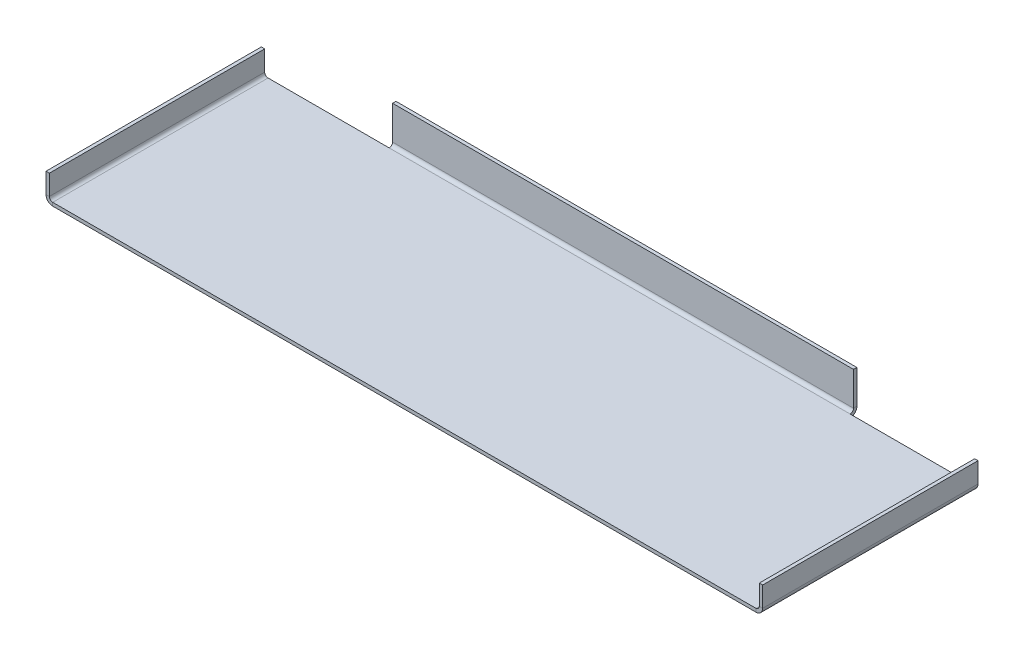
from build123d import *

# Parameters (mm, degrees)
SKETCH1_W                      = 676.28516
SKETCH1_H                      = 203.2
BASE_FLANGE1_DEPTH             = 3.175
EDGE_FLANGE2_STRIP_W           = 19.05
EDGE_FLANGE2_STRIP_H           = 3.175
EDGE_FLANGE2_STRIP_CUT_DEPTH   = 203.2
EDGE_FLANGE2_STRIP_2_W         = 19.05
EDGE_FLANGE2_STRIP_2_H         = 3.175
EDGE_FLANGE2_STRIP_CUT_2_DEPTH = 203.2
EDGE_FLANGE2_DEPTH             = 203.2
EDGE_FLANGE2_BEND_DEPTH        = 203.2
EDGE_FLANGE3_DEPTH             = 434.98516


# Sheet-metal steps are written as plain solids
with BuildPart() as part:
    # Sketch1 → Base-Flange1 (new body)
    with BuildSketch(Plane(origin=(0, 0, 0), x_dir=(1, 0, 0), z_dir=(0, 1, 0))):
        with Locations((338.14258, 101.6)):
            Rectangle(SKETCH1_W, SKETCH1_H)
    extrude(amount=-BASE_FLANGE1_DEPTH)

    # Edge-Flange2 strip (across the edge) → Edge-Flange2 strip cut (cut)
    with BuildSketch(Plane(origin=(676.28516, 0, 0), x_dir=(-1, 0, 0), z_dir=(0, 0, -1))):
        with Locations((-3.175, -1.5875)):
            Rectangle(EDGE_FLANGE2_STRIP_W, EDGE_FLANGE2_STRIP_H)
    extrude(amount=EDGE_FLANGE2_STRIP_CUT_DEPTH, mode=Mode.SUBTRACT)

    # Edge-Flange2 strip 2 (across the edge) → Edge-Flange2 strip cut 2 (cut)
    with BuildSketch(Plane.XY.offset(-203.2)):
        with Locations((-3.175, -1.5875)):
            Rectangle(EDGE_FLANGE2_STRIP_2_W, EDGE_FLANGE2_STRIP_2_H)
    extrude(amount=EDGE_FLANGE2_STRIP_CUT_2_DEPTH, mode=Mode.SUBTRACT)

    # Edge-Flange2 section (across the edge) → Edge-Flange2 (add)
    with BuildSketch(Plane(origin=(676.28516, 0, 0), x_dir=(-1, 0, 0), z_dir=(0, 0, -1))):
        with BuildLine():
            Line((0, 3.175), (0, 22.225))
            Line((0, 22.225), (3.175, 22.225))
            Line((3.175, 22.225), (3.175, 3.175))
            ThreePointArc((3.175, 3.175), (4.10493597, 0.92993597), (6.35, 0))
            Line((6.35, 0), (6.35, -3.175))
            ThreePointArc((6.35, -3.175), (1.859871939, -1.315128061), (0, 3.175))
        make_face()
    extrude(amount=EDGE_FLANGE2_DEPTH)

    # Edge-Flange2 section 2 (across the edge) → Edge-Flange2 bend (add)
    with BuildSketch(Plane.XY.offset(-203.2)):
        with BuildLine():
            Line((0, 3.175), (0, 22.225))
            Line((0, 22.225), (3.175, 22.225))
            Line((3.175, 22.225), (3.175, 3.175))
            ThreePointArc((3.175, 3.175), (4.10493597, 0.92993597), (6.35, 0))
            Line((6.35, 0), (6.35, -3.175))
            ThreePointArc((6.35, -3.175), (1.859871939, -1.315128061), (0, 3.175))
        make_face()
    extrude(amount=EDGE_FLANGE2_BEND_DEPTH)

    # Edge-Flange3 section (across the edge) → Edge-Flange3 (add)
    with BuildSketch(Plane(origin=(555.63516, 0, -206.375), x_dir=(0, 0, 1), z_dir=(-1, 0, 0))):
        with BuildLine():
            Line((-3.175, 3.175), (-3.175, 34.925))
            Line((-3.175, 34.925), (0, 34.925))
            Line((0, 34.925), (0, 3.175))
            ThreePointArc((0, 3.175), (0.92993597, 0.92993597), (3.175, 0))
            Line((3.175, 0), (3.175, -3.175))
            ThreePointArc((3.175, -3.175), (-1.315128061, -1.315128061), (-3.175, 3.175))
        make_face()
    extrude(amount=EDGE_FLANGE3_DEPTH)


solid = part.part
